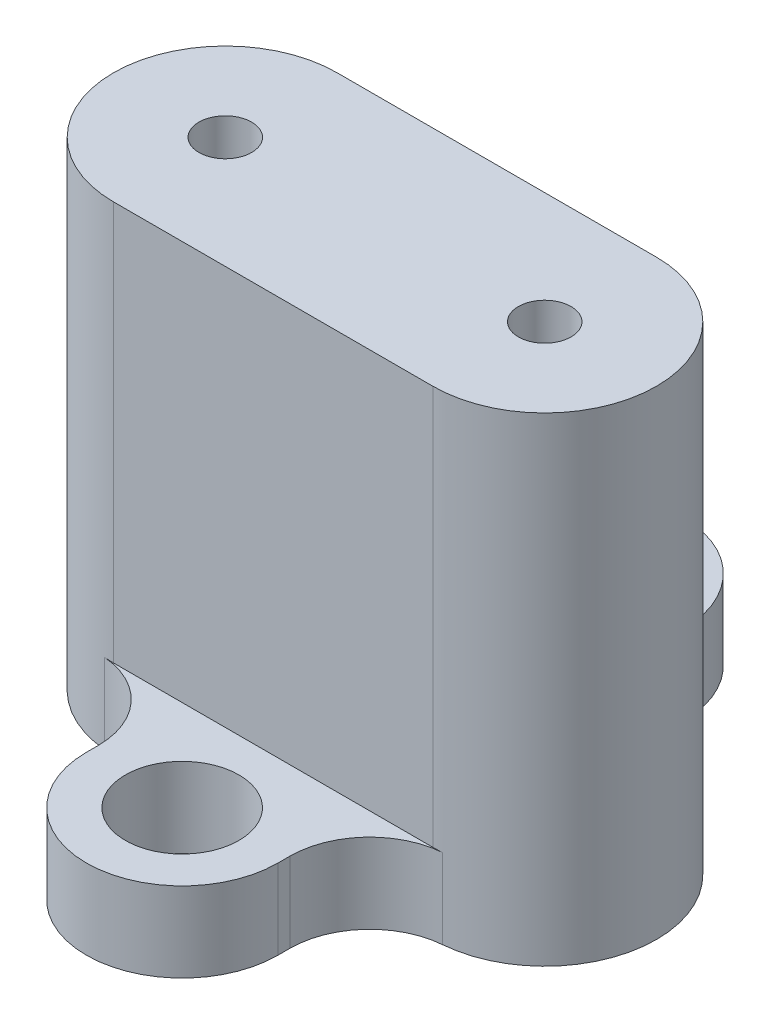
from build123d import *

# Parameters (mm, degrees)
BOSS_EXTRUDE1_DEPTH       = 30
M4X0_7_TAPPED_HOLE1_D     = 3.3
M4X0_7_TAPPED_HOLE1_DEPTH = 10.1
M4X0_7_TAPPED_HOLE1_TIP   = 0.991420021
SKETCH4_R                 = 3.556
BOSS_EXTRUDE2_DEPTH       = 5
FILLET1_R                 = 5


with BuildPart() as part:
    # Sketch1 → Boss-Extrude1 (new body)
    with BuildSketch(Plane(origin=(0, 0, 0), x_dir=(1, 0, 0), z_dir=(0, 1, 0))):
        with BuildLine():
            Line((-10, -7), (10, -7))
            ThreePointArc((10, -7), (17, 0), (10, 7))
            Line((10, 7), (-10, 7))
            ThreePointArc((-10, 7), (-17, 0), (-10, -7))
        make_face()
    extrude(amount=BOSS_EXTRUDE1_DEPTH)

    # M4x0.7 Tapped Hole1
    with Locations(Plane(origin=(0, 30, 0), x_dir=(1, 0, 0), z_dir=(0, 1, 0))):
        with Locations((-10, 0), (10, 0)):
            Hole(M4X0_7_TAPPED_HOLE1_D / 2, depth=M4X0_7_TAPPED_HOLE1_DEPTH)
            with Locations((0, 0, -(M4X0_7_TAPPED_HOLE1_DEPTH + M4X0_7_TAPPED_HOLE1_TIP / 2))):  # 118° drill point
                Cone(0, M4X0_7_TAPPED_HOLE1_D / 2, M4X0_7_TAPPED_HOLE1_TIP, mode=Mode.SUBTRACT)

    # Sketch4 → Boss-Extrude2 (add)
    with BuildSketch(Plane.XZ):
        with BuildLine():
            Line((6, 12.7), (6, -12.7))
            ThreePointArc((6, -12.7), (0, -18.7), (-6, -12.7))
            Line((-6, -12.7), (-6, 12.7))
            ThreePointArc((-6, 12.7), (0, 18.7), (6, 12.7))
        make_face()
        with Locations(Location((0, 12.7, 0), (0, 0, 270))):
            Circle(SKETCH4_R, mode=Mode.SUBTRACT)
        with Locations(Location((0, -12.7, 0), (0, 0, 270))):
            Circle(SKETCH4_R, mode=Mode.SUBTRACT)
    extrude(amount=-BOSS_EXTRUDE2_DEPTH)

    # Fillet1
    # the kernel refuses this fillet: 5 mm, written as the material it adds along each edge
    with BuildSketch(Plane(origin=(-6, 5, 7), x_dir=(-0.9999858901973535, 0, -0.0053121941047544466), z_dir=(0, -1, 0)), Plane(origin=(-6, 0, -7), x_dir=(-0.9999858901973535, 0, 0.005312194104754061), z_dir=(0, 1, 0)), Plane(origin=(6, 5, -7), x_dir=(0.9999858901973535, 0, 0.005312194104753284), z_dir=(0, -1, 0)), Plane(origin=(6, 0, 7), x_dir=(0.9999858901973535, 0, -0.0053121941047534794), z_dir=(0, 1, 0))) as fillet1_piece_1:
        with BuildLine():
            CenterArc((4.973590207, -4.984751754), FILLET1_R, 94.475824114, 85.219808153)
            Line((-0.026339243, -4.958190783), (-0.526332189, -4.955534686))
            Line((-0.526332189, -4.955534686), (-0.499992945, 0.002656097))
            Line((-0.499992945, 0.002656097), (0.002656097, 0.499992945))
            ThreePointArc((0.002656097, 0.499992945), (4.002599658, 0.478744169), (4.544378784, 0.498475175))
            Line((4.544378784, 0.498475175), (4.583398004, 0))
        make_face()
    extrude(amount=5)


solid = part.part
